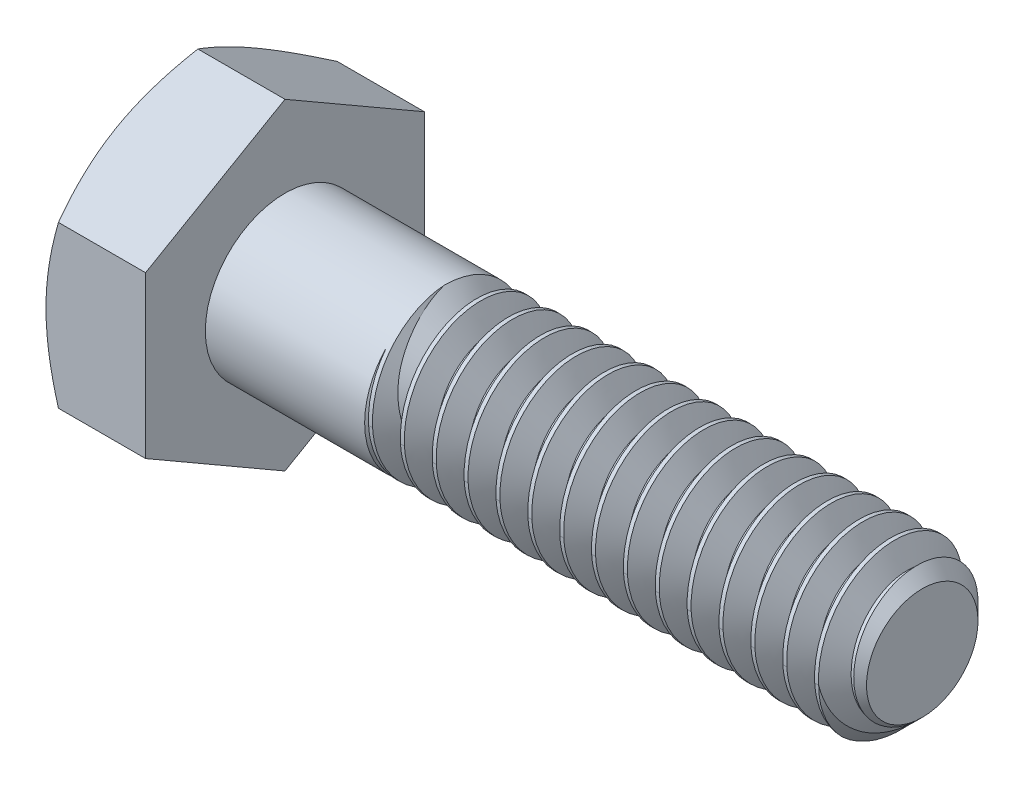
from build123d import *
from build123d.topology import SkipClean

# Parameters (mm, degrees)
SKETCH5_R           = 3.175
BOSS_EXTRUDE3_DEPTH = 25.4
CHAMFER1_SIZE       = 0.9525
CUT_SWEEP1_PITCH    = 1.27
BOSS_EXTRUDE4_DEPTH = 3.96875
SKETCH8_OUTSIDE_W   = 129.26
SKETCH8_OUTSIDE_H   = 130.98
SKETCH8_OUTSIDE_R   = 5.55625
CUT_EXTRUDE3_DEPTH  = 31.570540535
CUT_EXTRUDE3_DRAFT  = -60
CUT_EXTRUDE4_DEPTH  = 0.254
CIRPATTERN1_COUNT   = 3


with BuildPart() as part:
    # Sketch5 → Boss-Extrude3 (new body)
    with BuildSketch(Plane(origin=(14.684375, 0, 0), x_dir=(0, 0, -1), z_dir=(1, 0, 0))):
        Circle(SKETCH5_R)
    extrude(amount=-BOSS_EXTRUDE3_DEPTH)

    # Chamfer1
    chamfer1_edges = [part.edges().sort_by_distance(p)[0] for p in [
        (14.684375, 0, 3.175),
    ]]
    chamfer(chamfer1_edges, length=CHAMFER1_SIZE)

    # Cut-Sweep1: arcs per turn and ends read off the stored shape
    # Cut-Sweep1: the profile of Sketch10 profile screwed along a right-hand helix through 21 turns, 8 arcs to a turn; built about Z, then put on its axis
    cut_sweep1_z = Axis((0, 0, 0), (0, 0, 1))
    cut_sweep1_corners = [(3.1753, 0, 0.000173205), (2.350110803, 0, -0.47625), (2.350110803, 0, -0.635), (3.1753, 0, -1.111423205)]
    with BuildLine(mode=Mode.PRIVATE) as cut_sweep1_profile:
        Line(cut_sweep1_corners[0], cut_sweep1_corners[1])
        Line(cut_sweep1_corners[1], cut_sweep1_corners[2])
        Line(cut_sweep1_corners[2], cut_sweep1_corners[3])
        Line(cut_sweep1_corners[3], cut_sweep1_corners[0])
    cut_sweep1_cap = Face(cut_sweep1_profile.wire())
    cut_sweep1_turn_angles = [0, 22.5, 45, 67.5, 90, 112.5, 135, 157.5, 180, 202.5, 225, 247.5, 270, 292.5, 315, 337.5, 360]
    cut_sweep1_turn_weights = [1, 0.9238795325112867, 1, 0.9238795325112867, 1, 0.9238795325112867, 1, 0.9238795325112867, 1, 0.9238795325112867, 1, 0.9238795325112867, 1, 0.9238795325112867, 1, 0.9238795325112867, 1]
    cut_sweep1_turn_rails = [Edge.make_bspline([Vector(p[0], p[1], 0).rotate(cut_sweep1_z, cut_sweep1_turn_angles[k]) / cut_sweep1_turn_weights[k] + Vector(0, 0, p[2] + CUT_SWEEP1_PITCH * cut_sweep1_turn_angles[k] / 360) for k in range(17)], [0, 0, 0, 1, 1, 2, 2, 3, 3, 4, 4, 5, 5, 6, 6, 7, 7, 8, 8, 8], 2, cut_sweep1_turn_weights) for p in cut_sweep1_corners]
    cut_sweep1_turn_sides = [Face.make_surface_from_curves(cut_sweep1_turn_rails[p[0]], cut_sweep1_turn_rails[p[1]]) for p in [(0, 1), (1, 2), (2, 3), (3, 0)]]
    cut_sweep1 = Plane(origin=(14.684375, 0, 0), x_dir=(0, 1, 0), z_dir=(-1, 0, 0)) * Solid(Shell([*[p.moved(Location((0, 0, CUT_SWEEP1_PITCH * i))) for i in range(21) for p in cut_sweep1_turn_sides], cut_sweep1_cap, cut_sweep1_cap.rotate(cut_sweep1_z, 7560).moved(Location((0, 0, CUT_SWEEP1_PITCH * 7560 / 360)))]))
    add(cut_sweep1, mode=Mode.SUBTRACT)

    # Sketch11 → Revolve1 (revolve)
    with SkipClean():  # the faces are left unmerged after this step: merging them gives an invalid solid
        with BuildSketch(Plane.XY, mode=Mode.PRIVATE) as revolve1_sk:
            Polygon((-10.715625, 3.175), (-10.715625, 0), (-1.190625, 0), (-4.365625, 3.175), align=None)
        revolve(revolve1_sk.sketch.rotate(Axis((-10.715625, 0, 0), (1, 0, 0)), 270), axis=Axis((-10.715625, 0, 0), (1, 0, 0)))

    # Sketch6 → Boss-Extrude4 (add)
    with BuildSketch(Plane.ZY.offset(10.715625)):
        Polygon((5.55625, 3.207902433), (0, 6.415804866), (-5.55625, 3.207902433), (-5.55625, -3.207902433), (0, -6.415804866), (5.55625, -3.207902433), align=None)
    extrude(amount=BOSS_EXTRUDE4_DEPTH)


with BuildPart() as cut_extrude3_tool:
    # Sketch8 outside → Cut-Extrude3 (with draft: the straight prism first)
    with BuildSketch(Plane.ZY.offset(14.684375)):
        Rectangle(SKETCH8_OUTSIDE_W, SKETCH8_OUTSIDE_H)
        Circle(SKETCH8_OUTSIDE_R, mode=Mode.SUBTRACT)
    extrude(amount=-CUT_EXTRUDE3_DEPTH)
    # Cut-Extrude3: the draft: its side faces are tilted about the plane it starts from
    cut_extrude3_sides = [cut_extrude3_tool.faces().sort_by_distance(p)[0] for p in [
        (1.100895267, -65.49, 0),
        (1.100895267, 0, 64.63),
        (1.100895267, 65.49, 0),
        (1.100895267, 0, -64.63),
        (1.100895267, 0, -5.55625),
    ]]
    draft(cut_extrude3_sides, Plane.ZY.offset(14.684375), CUT_EXTRUDE3_DRAFT)


with BuildPart() as part_1:
    add(part.part)

    # Cut-Extrude3: cut by cut_extrude3_tool
    add(cut_extrude3_tool.part, mode=Mode.SUBTRACT)

    # Sketch12 → Cut-Extrude4 (cut)
    with BuildSketch(Plane.ZY.offset(14.684375)):
        with BuildLine():
            Line((0.1666875, 4.2783125), (0.1666875, 2.3891875))
            ThreePointArc((0.1666875, 2.3891875), (0, 2.2225), (-0.1666875, 2.3891875))
            Line((-0.1666875, 2.3891875), (-0.1666875, 4.2783125))
            ThreePointArc((-0.1666875, 4.2783125), (0, 4.445), (0.1666875, 4.2783125))
        make_face()
    cut_extrude4 = extrude(amount=-CUT_EXTRUDE4_DEPTH, mode=Mode.SUBTRACT)

    # CirPattern1: Cut-Extrude4 ×3 about axis
    cirpattern1_axis = Axis((0, 0, 0), (1, 0, 0))
    for i in range(1, CIRPATTERN1_COUNT):
        add(cut_extrude4.rotate(cirpattern1_axis, i * 360 / CIRPATTERN1_COUNT), mode=Mode.SUBTRACT)


solid = part_1.part
